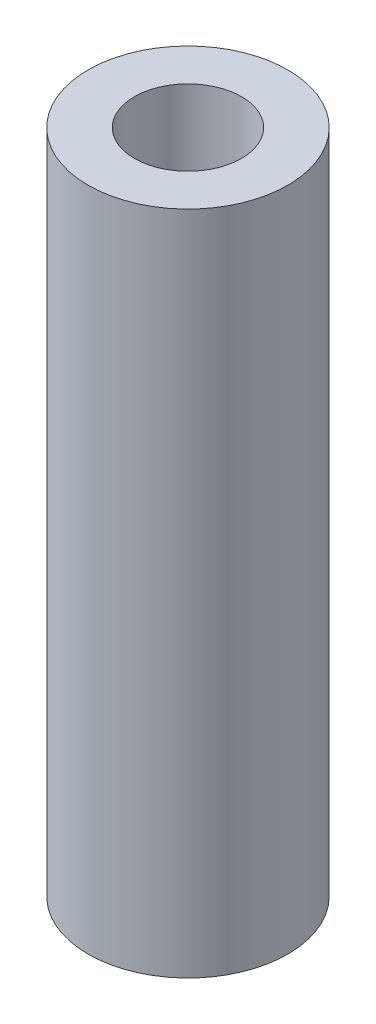
from build123d import *

# Parameters (mm, degrees)
SKETCH1_R           = 4.7625
SKETCH1_R_2         = 2.5527
BOSS_EXTRUDE1_DEPTH = 15.875


with BuildPart() as part:
    # Sketch1 → Boss-Extrude1 (new, symmetric)
    with BuildSketch(Plane(origin=(0, 0, 0), x_dir=(1, 0, 0), z_dir=(0, 1, 0))):
        Circle(SKETCH1_R)
        Circle(SKETCH1_R_2, mode=Mode.SUBTRACT)
    extrude(amount=BOSS_EXTRUDE1_DEPTH, both=True)


solid = part.part
